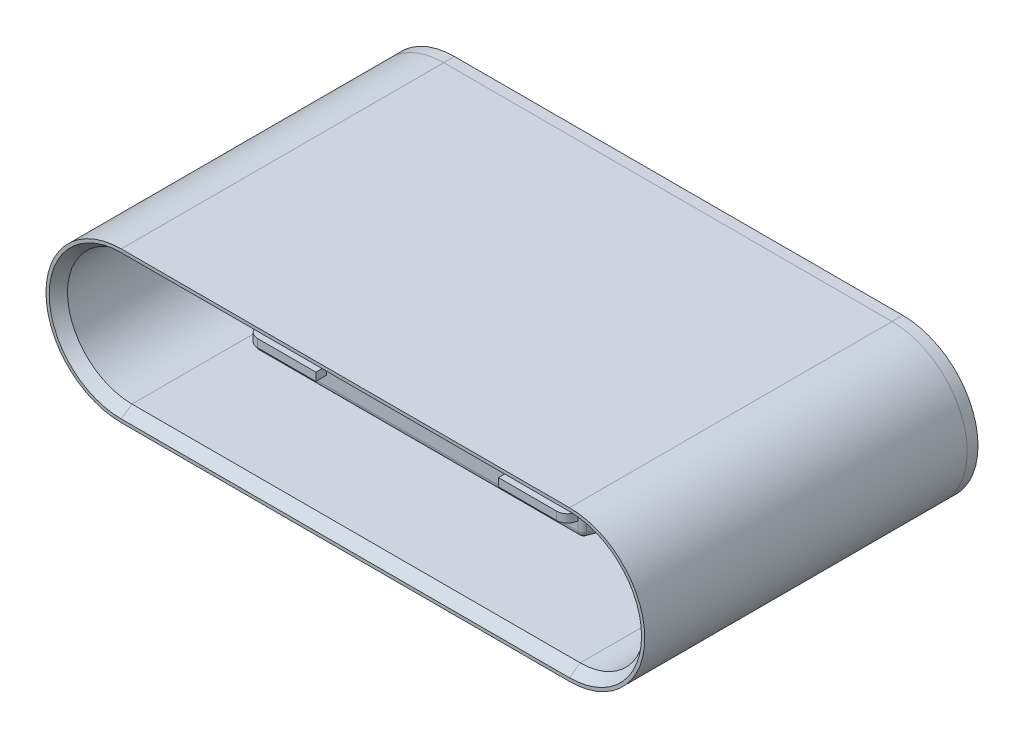
from build123d import *
from OCP.BRepFilletAPI import BRepFilletAPI_MakeChamfer

# Parameters (mm, degrees)
EXTRUDE_THIN1_DEPTH    = 6
CHAMFER1_SIZE          = 0.2
CHAMFER1_SIZE2         = 0.140041508
BOSS_EXTRUDE1_DEPTH    = 0.2
SKETCH3_W              = 6.7
SKETCH3_H              = 0.7
BOSS_EXTRUDE2_DEPTH    = 4.65
CHAMFER2_SIZE          = 0.75
CHAMFER2_SIZE2         = 0.3
FILLET1_R              = 0.1
SKETCH4_W              = 1.282296704
SKETCH4_H              = 0.15
BOSS_EXTRUDE3_DEPTH    = 0.2
BOSS_EXTRUDE3_2_DEPTH  = 0.2
FILLET2_R              = 0.2
FILLET3_R              = 0.2
SKETCH5_W              = 0.3
SKETCH5_H              = 3
BOSS_EXTRUDE4_DEPTH    = 0.1
BOSS_EXTRUDE4_2_DEPTH  = 0.1
BOSS_EXTRUDE4_3_DEPTH  = 0.1
BOSS_EXTRUDE4_4_DEPTH  = 0.1
BOSS_EXTRUDE4_5_DEPTH  = 0.1
BOSS_EXTRUDE4_6_DEPTH  = 0.1
BOSS_EXTRUDE4_7_DEPTH  = 0.1
BOSS_EXTRUDE4_8_DEPTH  = 0.1
BOSS_EXTRUDE4_9_DEPTH  = 0.1
BOSS_EXTRUDE4_10_DEPTH = 0.1
BOSS_EXTRUDE4_11_DEPTH = 0.1
BOSS_EXTRUDE4_12_DEPTH = 0.1
SKETCH8_W              = 0.3
SKETCH8_H              = 1
BOSS_EXTRUDE5_DEPTH    = 0.1
MIRROR1_START          = -2.95
MIRROR1_OUTLINE_W      = 0.1
MIRROR1_OUTLINE_H      = 4
MIRROR1_DEPTH          = 0.3
MIRROR1_START_2        = -1.42
MIRROR1_2_OUTLINE_W    = 0.1
MIRROR1_2_OUTLINE_H    = 4
MIRROR1_2_DEPTH        = 0.3
MIRROR1_START_3        = 1.12
MIRROR1_3_OUTLINE_W    = 0.1
MIRROR1_3_OUTLINE_H    = 4
MIRROR1_3_DEPTH        = 0.3
MIRROR1_START_4        = 2.65
MIRROR1_4_OUTLINE_W    = 0.1
MIRROR1_4_OUTLINE_H    = 4
MIRROR1_4_DEPTH        = 0.3
MIRROR1_START_5        = -2.44
MIRROR1_5_OUTLINE_W    = 0.1
MIRROR1_5_OUTLINE_H    = 3
MIRROR1_5_DEPTH        = 0.3
MIRROR1_START_6        = -1.93
MIRROR1_6_OUTLINE_W    = 0.1
MIRROR1_6_OUTLINE_H    = 3
MIRROR1_6_DEPTH        = 0.3
MIRROR1_START_7        = -0.91
MIRROR1_7_OUTLINE_W    = 0.1
MIRROR1_7_OUTLINE_H    = 3
MIRROR1_7_DEPTH        = 0.3
MIRROR1_START_8        = -0.4
MIRROR1_8_OUTLINE_W    = 0.1
MIRROR1_8_OUTLINE_H    = 3
MIRROR1_8_DEPTH        = 0.3
MIRROR1_START_9        = 0.1
MIRROR1_9_OUTLINE_W    = 0.1
MIRROR1_9_OUTLINE_H    = 3
MIRROR1_9_DEPTH        = 0.3
MIRROR1_START_10       = 0.61
MIRROR1_10_OUTLINE_W   = 0.1
MIRROR1_10_OUTLINE_H   = 3
MIRROR1_10_DEPTH       = 0.3
MIRROR1_START_11       = 1.63
MIRROR1_11_OUTLINE_W   = 0.1
MIRROR1_11_OUTLINE_H   = 3
MIRROR1_11_DEPTH       = 0.3
MIRROR1_START_12       = 2.14
MIRROR1_12_OUTLINE_W   = 0.1
MIRROR1_12_OUTLINE_H   = 3
MIRROR1_12_DEPTH       = 0.3


# Read off the part's stored shape, not the designer's step: Mirror1
with BuildPart() as part:
    # Sketch1 → Extrude-Thin1 (new body)
    with BuildSketch(Plane.XY):
        with BuildLine():
            Line((4.17, -1.4), (-4.17, -1.4))
            ThreePointArc((-4.17, -1.4), (-5.57, 0), (-4.17, 1.4))
            Line((-4.17, 1.4), (4.17, 1.4))
            ThreePointArc((4.17, 1.4), (5.57, 0), (4.17, -1.4))
        make_face()
        with BuildLine():
            Line((4.17, -1.2), (-4.17, -1.2))
            ThreePointArc((-4.17, -1.2), (-5.37, 0), (-4.17, 1.2))
            Line((-4.17, 1.2), (4.17, 1.2))
            ThreePointArc((4.17, 1.2), (5.37, 0), (4.17, -1.2))
        make_face(mode=Mode.SUBTRACT)
    extrude(amount=-EXTRUDE_THIN1_DEPTH)

    # Chamfer1: one chamfer whose edges measure the first distance from different faces: ONE call of the kernel's chamfer builder (chamfer() names one face for all edges)
    chamfer1_edges_1 = [part.edges().sort_by_distance(p)[0] for p in [
        (-5.37, 0, 0),
    ]]
    chamfer1_side_1 = [part.faces().sort_by_distance(p)[0] for p in [
        (-5.37, 0, -3),
    ]]
    chamfer1_edges_2 = [part.edges().sort_by_distance(p)[0] for p in [
        (0, -1.2, 0),
    ]]
    chamfer1_side_2 = [part.faces().sort_by_distance(p)[0] for p in [
        (0, -1.2, -3),
    ]]
    chamfer1_edges_3 = [part.edges().sort_by_distance(p)[0] for p in [
        (5.37, 0, 0),
    ]]
    chamfer1_side_3 = [part.faces().sort_by_distance(p)[0] for p in [
        (5.37, 0, -3),
    ]]
    chamfer1_edges_4 = [part.edges().sort_by_distance(p)[0] for p in [
        (0, 1.2, 0),
    ]]
    chamfer1_side_4 = [part.faces().sort_by_distance(p)[0] for p in [
        (0, 1.2, -3),
    ]]
    chamfer1 = BRepFilletAPI_MakeChamfer(part.part.solid().wrapped)
    for e in chamfer1_edges_1:
        chamfer1.Add(CHAMFER1_SIZE, CHAMFER1_SIZE2, e.wrapped, chamfer1_side_1[0].wrapped)  # the first distance lies on this face
    for e in chamfer1_edges_2:
        chamfer1.Add(CHAMFER1_SIZE, CHAMFER1_SIZE2, e.wrapped, chamfer1_side_2[0].wrapped)  # the first distance lies on this face
    for e in chamfer1_edges_3:
        chamfer1.Add(CHAMFER1_SIZE, CHAMFER1_SIZE2, e.wrapped, chamfer1_side_3[0].wrapped)  # the first distance lies on this face
    for e in chamfer1_edges_4:
        chamfer1.Add(CHAMFER1_SIZE, CHAMFER1_SIZE2, e.wrapped, chamfer1_side_4[0].wrapped)  # the first distance lies on this face
    add(Compound.cast(chamfer1.Shape()), mode=Mode.REPLACE)


with BuildPart() as body_2:
    # Sketch2 → Boss-Extrude1 (new body)
    with BuildSketch(Plane(origin=(0, 0, -6), x_dir=(-1, 0, 0), z_dir=(0, 0, -1))):
        with BuildLine():
            Line((4.17, 1.4), (-4.17, 1.4))
            ThreePointArc((-4.17, 1.4), (-5.57, 0), (-4.17, -1.4))
            Line((-4.17, -1.4), (4.17, -1.4))
            ThreePointArc((4.17, -1.4), (5.57, 0), (4.17, 1.4))
        make_face()
    extrude(amount=BOSS_EXTRUDE1_DEPTH)


with BuildPart() as body_3:
    # Sketch3 → Boss-Extrude2 (new body)
    with BuildSketch(Plane.XY.offset(-6)):
        Rectangle(SKETCH3_W, SKETCH3_H)
    extrude(amount=BOSS_EXTRUDE2_DEPTH)

    # Chamfer2: one chamfer whose edges measure the first distance from different faces: ONE call of the kernel's chamfer builder (chamfer() names one face for all edges)
    chamfer2_edges_1 = [body_3.edges().sort_by_distance(p)[0] for p in [
        (-3.35, 0, -1.35),
    ]]
    chamfer2_side_1 = [body_3.faces().sort_by_distance(p)[0] for p in [
        (-3.35, 0, -3.675),
    ]]
    chamfer2_edges_2 = [body_3.edges().sort_by_distance(p)[0] for p in [
        (3.35, 0, -1.35),
    ]]
    chamfer2_side_2 = [body_3.faces().sort_by_distance(p)[0] for p in [
        (3.35, 0, -3.675),
    ]]
    chamfer2 = BRepFilletAPI_MakeChamfer(body_3.part.solid().wrapped)
    for e in chamfer2_edges_1:
        chamfer2.Add(CHAMFER2_SIZE, CHAMFER2_SIZE2, e.wrapped, chamfer2_side_1[0].wrapped)  # the first distance lies on this face
    for e in chamfer2_edges_2:
        chamfer2.Add(CHAMFER2_SIZE, CHAMFER2_SIZE2, e.wrapped, chamfer2_side_2[0].wrapped)  # the first distance lies on this face
    add(Compound.cast(chamfer2.Shape()), mode=Mode.REPLACE)

    # Fillet1
    fillet1_edges = [body_3.edges().sort_by_distance(p)[0] for p in [
        (0, 0.35, -1.35),
        (0, -0.35, -1.35),
        (3.05, 0, -1.35),
        (-3.05, 0, -1.35),
        (3.35, -0.35, -4.05),
        (-3.35, -0.35, -4.05),
        (3.2, -0.35, -1.725),
        (-3.2, -0.35, -1.725),
        (-3.35, 0.35, -4.05),
        (-3.35, 0, -2.1),
        (3.35, 0.35, -4.05),
        (3.2, 0.35, -1.725),
        (-3.2, 0.35, -1.725),
        (3.35, 0, -2.1),
    ]]
    fillet(fillet1_edges, radius=FILLET1_R)


with BuildPart() as body_4:
    # Sketch4 → Boss-Extrude3 (new body)
    with BuildSketch(Plane.XY.offset(-1.35)):
        with Locations((-2.341148352, 0)):
            Rectangle(SKETCH4_W, SKETCH4_H)
    extrude(amount=BOSS_EXTRUDE3_DEPTH)

    # Fillet3
    fillet3_edges = [body_4.edges().sort_by_distance(p)[0] for p in [
        (-2.982296704, 0, -1.15),
    ]]
    fillet(fillet3_edges, radius=FILLET3_R - 0.0001)  # a hair under: the kernel refuses the full size


with BuildPart() as body_5:
    # Sketch4 → Boss-Extrude3 2 (new body)
    with BuildSketch(Plane.XY.offset(-1.35)):
        with Locations((2.341148352, 0)):
            Rectangle(SKETCH4_W, SKETCH4_H)
    extrude(amount=BOSS_EXTRUDE3_2_DEPTH)

    # Fillet2
    fillet2_edges = [body_5.edges().sort_by_distance(p)[0] for p in [
        (2.982296704, 0, -1.15),
    ]]
    fillet(fillet2_edges, radius=FILLET2_R - 0.0001)  # a hair under: the kernel refuses the full size


with BuildPart() as body_6:
    # Sketch5 → Boss-Extrude4 (new body)
    with BuildSketch(Plane(origin=(0, 0.35, 0), x_dir=(1, 0, 0), z_dir=(0, 1, 0))):
        with Locations((-2.8, 4.5)):
            Rectangle(SKETCH5_W, SKETCH5_H)
    extrude(amount=BOSS_EXTRUDE4_DEPTH)



with BuildPart() as body_7:
    # Sketch5 → Boss-Extrude4 2 (new body)
    with BuildSketch(Plane(origin=(0, 0.35, 0), x_dir=(1, 0, 0), z_dir=(0, 1, 0))):
        with Locations((-2.29, 4.5)):
            Rectangle(SKETCH5_W, SKETCH5_H)
    extrude(amount=BOSS_EXTRUDE4_2_DEPTH)


with BuildPart() as body_8:
    # Sketch5 → Boss-Extrude4 3 (new body)
    with BuildSketch(Plane(origin=(0, 0.35, 0), x_dir=(1, 0, 0), z_dir=(0, 1, 0))):
        with Locations((-1.78, 4.5)):
            Rectangle(SKETCH5_W, SKETCH5_H)
    extrude(amount=BOSS_EXTRUDE4_3_DEPTH)


with BuildPart() as body_9:
    # Sketch5 → Boss-Extrude4 4 (new body)
    with BuildSketch(Plane(origin=(0, 0.35, 0), x_dir=(1, 0, 0), z_dir=(0, 1, 0))):
        with Locations((-1.27, 4.5)):
            Rectangle(SKETCH5_W, SKETCH5_H)
    extrude(amount=BOSS_EXTRUDE4_4_DEPTH)


with BuildPart() as body_10:
    # Sketch5 → Boss-Extrude4 5 (new body)
    with BuildSketch(Plane(origin=(0, 0.35, 0), x_dir=(1, 0, 0), z_dir=(0, 1, 0))):
        with Locations((-0.76, 4.5)):
            Rectangle(SKETCH5_W, SKETCH5_H)
    extrude(amount=BOSS_EXTRUDE4_5_DEPTH)


with BuildPart() as body_11:
    # Sketch5 → Boss-Extrude4 6 (new body)
    with BuildSketch(Plane(origin=(0, 0.35, 0), x_dir=(1, 0, 0), z_dir=(0, 1, 0))):
        with Locations((-0.25, 4.5)):
            Rectangle(SKETCH5_W, SKETCH5_H)
    extrude(amount=BOSS_EXTRUDE4_6_DEPTH)


with BuildPart() as body_12:
    # Sketch5 → Boss-Extrude4 7 (new body)
    with BuildSketch(Plane(origin=(0, 0.35, 0), x_dir=(1, 0, 0), z_dir=(0, 1, 0))):
        with Locations((0.25, 4.5)):
            Rectangle(SKETCH5_W, SKETCH5_H)
    extrude(amount=BOSS_EXTRUDE4_7_DEPTH)


with BuildPart() as body_13:
    # Sketch5 → Boss-Extrude4 8 (new body)
    with BuildSketch(Plane(origin=(0, 0.35, 0), x_dir=(1, 0, 0), z_dir=(0, 1, 0))):
        with Locations((0.76, 4.5)):
            Rectangle(SKETCH5_W, SKETCH5_H)
    extrude(amount=BOSS_EXTRUDE4_8_DEPTH)


with BuildPart() as body_14:
    # Sketch5 → Boss-Extrude4 9 (new body)
    with BuildSketch(Plane(origin=(0, 0.35, 0), x_dir=(1, 0, 0), z_dir=(0, 1, 0))):
        with Locations((1.27, 4.5)):
            Rectangle(SKETCH5_W, SKETCH5_H)
    extrude(amount=BOSS_EXTRUDE4_9_DEPTH)


with BuildPart() as body_15:
    # Sketch5 → Boss-Extrude4 10 (new body)
    with BuildSketch(Plane(origin=(0, 0.35, 0), x_dir=(1, 0, 0), z_dir=(0, 1, 0))):
        with Locations((1.78, 4.5)):
            Rectangle(SKETCH5_W, SKETCH5_H)
    extrude(amount=BOSS_EXTRUDE4_10_DEPTH)


with BuildPart() as body_16:
    # Sketch5 → Boss-Extrude4 11 (new body)
    with BuildSketch(Plane(origin=(0, 0.35, 0), x_dir=(1, 0, 0), z_dir=(0, 1, 0))):
        with Locations((2.29, 4.5)):
            Rectangle(SKETCH5_W, SKETCH5_H)
    extrude(amount=BOSS_EXTRUDE4_11_DEPTH)


with BuildPart() as body_17:
    # Sketch5 → Boss-Extrude4 12 (new body)
    with BuildSketch(Plane(origin=(0, 0.35, 0), x_dir=(1, 0, 0), z_dir=(0, 1, 0))):
        with Locations((2.8, 4.5)):
            Rectangle(SKETCH5_W, SKETCH5_H)
    extrude(amount=BOSS_EXTRUDE4_12_DEPTH)


with BuildPart() as body_6_1:
    add(body_6.part)

    add(body_9.part)  # Boss-Extrude5 merges body 9

    add(body_14.part)  # Boss-Extrude5 merges body 14

    add(body_17.part)  # Boss-Extrude5 merges body 17
    # Sketch8 → Boss-Extrude5 (add)
    with BuildSketch(Plane(origin=(0, 0.45, 0), x_dir=(1, 0, 0), z_dir=(0, 1, 0))):
        with Locations((-2.8, 2.5)):
            Rectangle(SKETCH8_W, SKETCH8_H)
        with Locations((-1.27, 2.5)):
            Rectangle(SKETCH8_W, SKETCH8_H)
        with Locations((2.8, 2.5)):
            Rectangle(SKETCH8_W, SKETCH8_H)
        with Locations((1.27, 2.5)):
            Rectangle(SKETCH8_W, SKETCH8_H)
    extrude(amount=-BOSS_EXTRUDE5_DEPTH)


with BuildPart() as body_15_2:
    # Mirror1 outline → Mirror1 (new body)
    with BuildSketch(Plane.YZ.offset(MIRROR1_START)):
        with Locations((-0.4, -4)):
            Rectangle(MIRROR1_OUTLINE_W, MIRROR1_OUTLINE_H)
    extrude(amount=MIRROR1_DEPTH)


with BuildPart() as body_16_2:
    # Mirror1 2 outline → Mirror1 2 (new body)
    with BuildSketch(Plane.YZ.offset(MIRROR1_START_2)):
        with Locations((-0.4, -4)):
            Rectangle(MIRROR1_2_OUTLINE_W, MIRROR1_2_OUTLINE_H)
    extrude(amount=MIRROR1_2_DEPTH)


with BuildPart() as body_17_2:
    # Mirror1 3 outline → Mirror1 3 (new body)
    with BuildSketch(Plane.YZ.offset(MIRROR1_START_3)):
        with Locations((-0.4, -4)):
            Rectangle(MIRROR1_3_OUTLINE_W, MIRROR1_3_OUTLINE_H)
    extrude(amount=MIRROR1_3_DEPTH)


with BuildPart() as body_18:
    # Mirror1 4 outline → Mirror1 4 (new body)
    with BuildSketch(Plane.YZ.offset(MIRROR1_START_4)):
        with Locations((-0.4, -4)):
            Rectangle(MIRROR1_4_OUTLINE_W, MIRROR1_4_OUTLINE_H)
    extrude(amount=MIRROR1_4_DEPTH)


with BuildPart() as body_19:
    # Mirror1 5 outline → Mirror1 5 (new body)
    with BuildSketch(Plane.YZ.offset(MIRROR1_START_5)):
        with Locations((-0.4, -4.5)):
            Rectangle(MIRROR1_5_OUTLINE_W, MIRROR1_5_OUTLINE_H)
    extrude(amount=MIRROR1_5_DEPTH)


with BuildPart() as body_20:
    # Mirror1 6 outline → Mirror1 6 (new body)
    with BuildSketch(Plane.YZ.offset(MIRROR1_START_6)):
        with Locations((-0.4, -4.5)):
            Rectangle(MIRROR1_6_OUTLINE_W, MIRROR1_6_OUTLINE_H)
    extrude(amount=MIRROR1_6_DEPTH)


with BuildPart() as body_21:
    # Mirror1 7 outline → Mirror1 7 (new body)
    with BuildSketch(Plane.YZ.offset(MIRROR1_START_7)):
        with Locations((-0.4, -4.5)):
            Rectangle(MIRROR1_7_OUTLINE_W, MIRROR1_7_OUTLINE_H)
    extrude(amount=MIRROR1_7_DEPTH)


with BuildPart() as body_22:
    # Mirror1 8 outline → Mirror1 8 (new body)
    with BuildSketch(Plane.YZ.offset(MIRROR1_START_8)):
        with Locations((-0.4, -4.5)):
            Rectangle(MIRROR1_8_OUTLINE_W, MIRROR1_8_OUTLINE_H)
    extrude(amount=MIRROR1_8_DEPTH)


with BuildPart() as body_23:
    # Mirror1 9 outline → Mirror1 9 (new body)
    with BuildSketch(Plane.YZ.offset(MIRROR1_START_9)):
        with Locations((-0.4, -4.5)):
            Rectangle(MIRROR1_9_OUTLINE_W, MIRROR1_9_OUTLINE_H)
    extrude(amount=MIRROR1_9_DEPTH)


with BuildPart() as body_24:
    # Mirror1 10 outline → Mirror1 10 (new body)
    with BuildSketch(Plane.YZ.offset(MIRROR1_START_10)):
        with Locations((-0.4, -4.5)):
            Rectangle(MIRROR1_10_OUTLINE_W, MIRROR1_10_OUTLINE_H)
    extrude(amount=MIRROR1_10_DEPTH)


with BuildPart() as body_25:
    # Mirror1 11 outline → Mirror1 11 (new body)
    with BuildSketch(Plane.YZ.offset(MIRROR1_START_11)):
        with Locations((-0.4, -4.5)):
            Rectangle(MIRROR1_11_OUTLINE_W, MIRROR1_11_OUTLINE_H)
    extrude(amount=MIRROR1_11_DEPTH)


with BuildPart() as body_26:
    # Mirror1 12 outline → Mirror1 12 (new body)
    with BuildSketch(Plane.YZ.offset(MIRROR1_START_12)):
        with Locations((-0.4, -4.5)):
            Rectangle(MIRROR1_12_OUTLINE_W, MIRROR1_12_OUTLINE_H)
    extrude(amount=MIRROR1_12_DEPTH)


solid = Compound([part.part, body_2.part, body_3.part, body_4.part, body_5.part, body_7.part, body_8.part, body_10.part, body_11.part, body_12.part, body_13.part, body_15.part, body_16.part, body_6_1.part, body_15_2.part, body_16_2.part, body_17_2.part, body_18.part, body_19.part, body_20.part, body_21.part, body_22.part, body_23.part, body_24.part, body_25.part, body_26.part])
